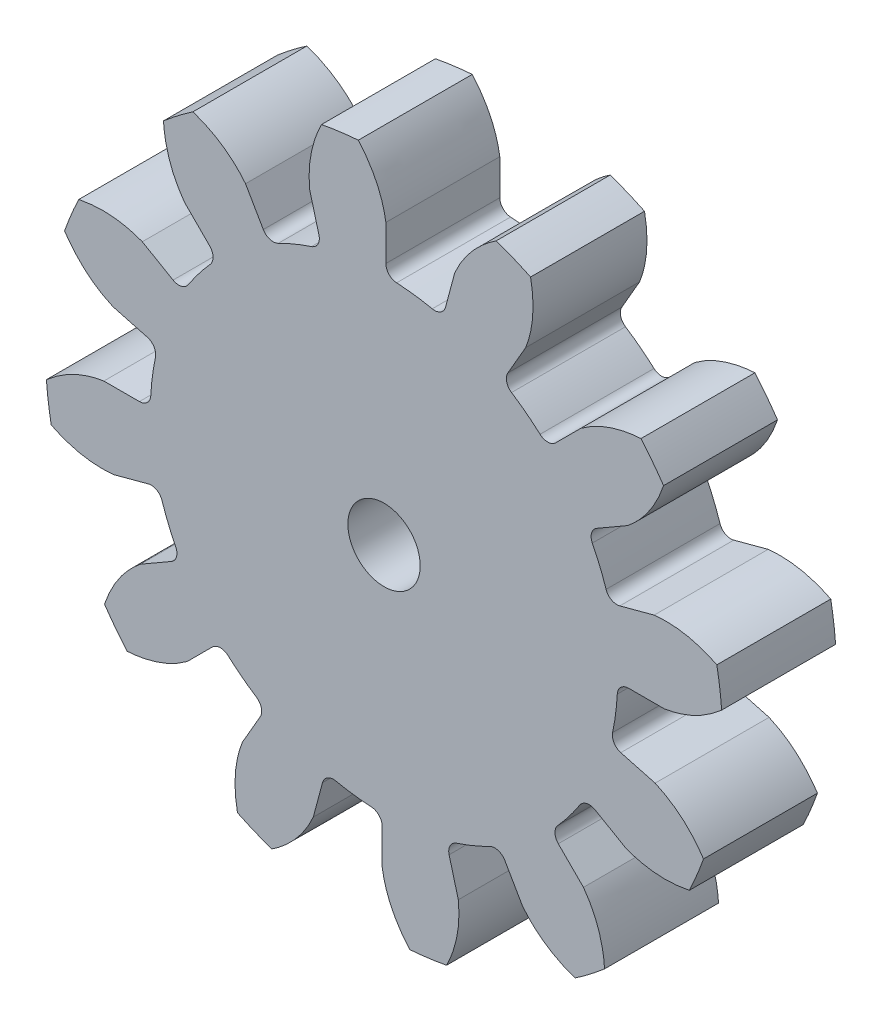
from build123d import *

# Parameters (mm, degrees)
SKETCH1_R                = 14.859
BOSS_EXTRUDE1_DEPTH      = 5
CUT_EXTRUDE1_DEPTH       = 22.600457449
FILLET1_R                = 0.498729
CIRPATTERN1_COUNT        = 12
FILLET1_OF_CIRPATTERN1_R = 0.498729
SKETCH5_R                = 1.5875
CUT_EXTRUDE2_DEPTH       = 22.541370702


with BuildPart() as part:
    # Sketch1 → Boss-Extrude1 (new body)
    with BuildSketch(Plane.XY):
        Circle(SKETCH1_R)
    extrude(amount=-BOSS_EXTRUDE1_DEPTH)

    # Sketch4 → Cut-Extrude1 (cut, through all)
    with BuildSketch(Plane.XY):
        with BuildLine():
            Line((0.080131787, 12.295213914), (0.080131787, 10.250703468))
            ThreePointArc((0.080131787, 10.250703468), (1.338029283, 10.163317388), (2.575681995, 9.922157274))
            Line((2.575681995, 9.922157274), (3.104841445, 11.897002391))
            add(Edge.make_bspline(
                [(5.071151281, 14.112882844), (3.70540161, 13.261726884), (3.104841445, 11.897002391)],
                knots=[0, 0, 0, 1, 1, 1], degree=2))
            ThreePointArc((5.071151281, 14.112882844), (1.957418943, 14.868037818), (-1.245663981, 14.944509317))
            add(Edge.make_bspline(
                [(-1.245663981, 14.944509317), (-0.146747194, 13.768873094), (0.080131787, 12.295213914)],
                knots=[0, 0, 0, 1, 1, 1], degree=2))
        make_face()
    cut_extrude1 = extrude(amount=-CUT_EXTRUDE1_DEPTH, mode=Mode.SUBTRACT)

    # Fillet1
    fillet1_edges = [part.edges().sort_by_distance(p)[0] for p in [
        (2.575681995, 9.922157274, -2.5),
        (0.080131787, 10.250703468, -2.5),
    ]]
    fillet(fillet1_edges, radius=FILLET1_R)

    # CirPattern1: Cut-Extrude1 ×12 about axis
    cirpattern1_axis = Axis((0, 0, -5), (0, 0, 1))
    for i in range(1, CIRPATTERN1_COUNT):
        add(cut_extrude1.rotate(cirpattern1_axis, i * 360 / CIRPATTERN1_COUNT), mode=Mode.SUBTRACT)

    # Fillet1 of CirPattern1
    fillet1_of_cirpattern1_edges = [part.edges().sort_by_distance(p)[0] for p in [
        (-2.730472597, 9.880681257, -2.5),
        (-5.055955571, 8.917435504, -2.5),
        (-7.304999262, 7.191684677, -2.5),
        (-8.837303717, 5.194747897, -2.5),
        (-9.922157274, 2.575681995, -2.5),
        (-10.250703468, 0.080131787, -2.5),
        (-9.880681257, -2.730472597, -2.5),
        (-8.917435504, -5.055955571, -2.5),
        (-7.191684677, -7.304999262, -2.5),
        (-5.194747897, -8.837303717, -2.5),
        (-2.575681995, -9.922157274, -2.5),
        (-0.080131787, -10.250703468, -2.5),
        (2.730472597, -9.880681257, -2.5),
        (5.055955571, -8.917435504, -2.5),
        (7.304999262, -7.191684677, -2.5),
        (8.837303717, -5.194747897, -2.5),
        (9.922157274, -2.575681995, -2.5),
        (10.250703468, -0.080131787, -2.5),
        (9.880681257, 2.730472597, -2.5),
        (8.917435504, 5.055955571, -2.5),
        (7.191684677, 7.304999262, -2.5),
        (5.194747897, 8.837303717, -2.5),
    ]]
    fillet(fillet1_of_cirpattern1_edges, radius=FILLET1_OF_CIRPATTERN1_R)

    # Sketch5 → Cut-Extrude2 (cut, through all)
    with BuildSketch(Plane.XY):
        Circle(SKETCH5_R)
    extrude(amount=-CUT_EXTRUDE2_DEPTH, mode=Mode.SUBTRACT)


solid = part.part
